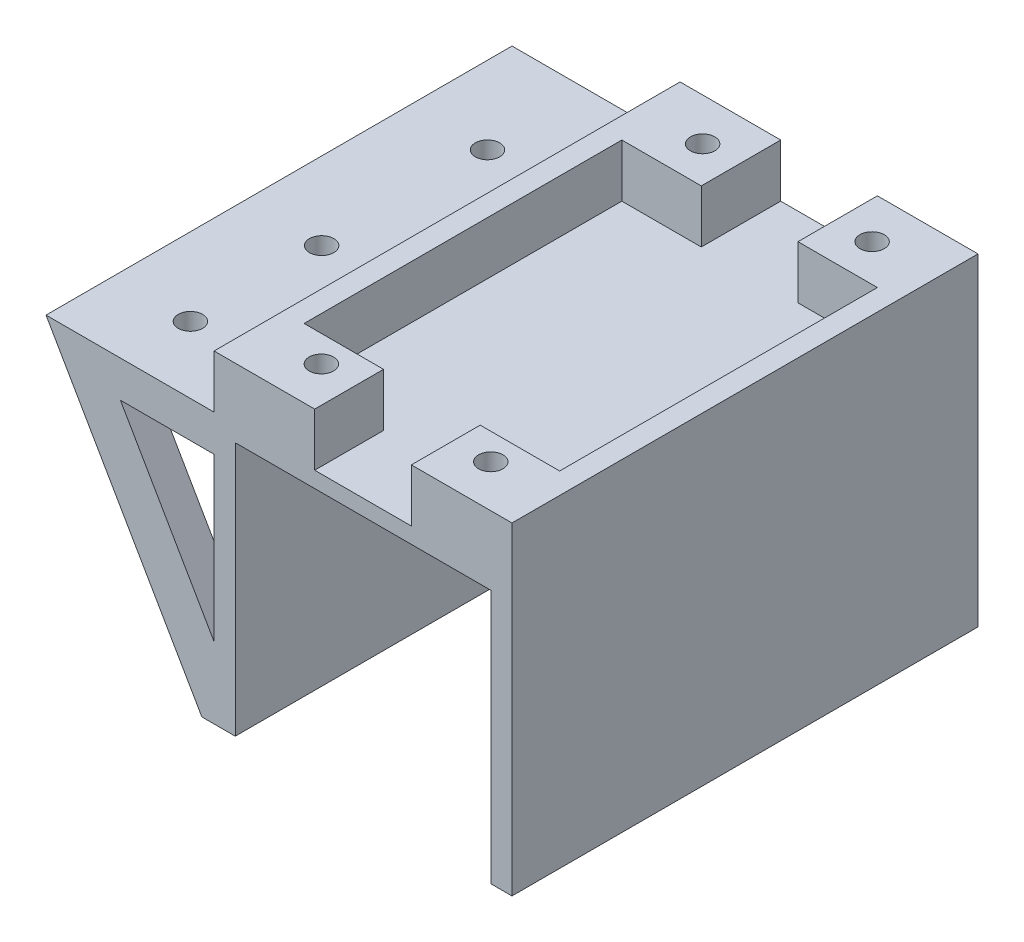
from build123d import *

# Parameters (mm, degrees)
SKETCH1_W            = 48.254
SKETCH1_H            = 10
BOSS_EXTRUDE1_DEPTH  = 70
BOSS_EXTRUDE3_DEPTH  = 8
BOSS_EXTRUDE4_DEPTH  = 8
BOSS_EXTRUDE5_DEPTH  = 8
BOSS_EXTRUDE6_DEPTH  = 70
SKETCH7_W            = 40.394634483
SKETCH7_H            = 17
CUT_EXTRUDE3_DEPTH   = 70
BOSS_EXTRUDE7_DEPTH  = 70
BOSS_EXTRUDE10_DEPTH = 8
BOSS_EXTRUDE11_DEPTH = 70
SKETCH13_W           = 83.001411072
SKETCH13_H           = 87.868559997
CUT_EXTRUDE4_DEPTH   = 4
SKETCH14_W           = 48.254
SKETCH14_H           = 10
BOSS_EXTRUDE12_DEPTH = 20
SKETCH16_W           = 56.254
SKETCH16_H           = 5
CUT_EXTRUDE5_DEPTH   = 100
SKETCH17_W           = 15
SKETCH17_H           = 15
BOSS_EXTRUDE14_DEPTH = 13
CUT_EXTRUDE8_DEPTH   = 5
SKETCH21_R           = 2.3
CUT_EXTRUDE9_DEPTH   = 15
SKETCH23_W           = 12
SKETCH23_H           = 40.530858039
CUT_EXTRUDE10_DEPTH  = 9
SKETCH25_R           = 2.3
CUT_EXTRUDE11_DEPTH  = 20
SKETCH26_R           = 2.3
CUT_EXTRUDE12_DEPTH  = 20
BOSS_EXTRUDE16_DEPTH = 20
SKETCH28_W           = 15
SKETCH28_H           = 15
BOSS_EXTRUDE17_DEPTH = 10
SKETCH29_R           = 2.3
CUT_EXTRUDE13_DEPTH  = 20
SKETCH30_W           = 10.391026801
SKETCH30_H           = 12
BOSS_EXTRUDE18_DEPTH = 5
SKETCH31_R           = 2.3
CUT_EXTRUDE14_DEPTH  = 45
SKETCH36_R           = 60.036471347
CUT_EXTRUDE15_DEPTH  = 2


with BuildPart() as part:
    # Sketch1 → Boss-Extrude1 (new body)
    with BuildSketch(Plane.XY):
        Polygon((0, 70), (0, 0), (4, 0), (4, 52), (52.254, 52), (52.254, 0), (56.254, 0), (56.254, 70), align=None)
        with Locations((28.127, 60)):
            Rectangle(SKETCH1_W, SKETCH1_H, mode=Mode.SUBTRACT)
    extrude(amount=BOSS_EXTRUDE1_DEPTH)

    # Sketch3 → Boss-Extrude3 (add)
    with BuildSketch(Plane.XY.offset(70)):
        Polygon((0, 62.5), (0, 70), (-40.394634483, 70), (0, 0.034440722), (0, 17.466679003), (-26, 62.5), align=None)
    extrude(amount=-BOSS_EXTRUDE3_DEPTH)

    # Sketch4 → Boss-Extrude4 (add)
    with BuildSketch(Plane(origin=(0, 0, 0), x_dir=(-1, 0, 0), z_dir=(0, 0, -1))):
        Polygon((0, 70), (40.394634483, 70), (0, 0), (0, 17.466679003), (26, 62.5), (0, 62.5), align=None)
    extrude(amount=-BOSS_EXTRUDE4_DEPTH)

    # Sketch5 → Boss-Extrude5 (add)
    with BuildSketch(Plane(origin=(0, 0, 39), x_dir=(-1, 0, 0), z_dir=(0, 0, -1))):
        Polygon((0, 62.5), (0, 70), (40.394634483, 70), (0, 0), (0, 17.466679003), (26, 62.5), align=None)
    extrude(amount=BOSS_EXTRUDE5_DEPTH)

    # Sketch6 → Boss-Extrude6 (add)
    with BuildSketch(Plane(origin=(0, 0, 0), x_dir=(-1, 0, 0), z_dir=(0, 0, -1))):
        Polygon((0, 62.5), (36.066637932, 62.5), (40.394634483, 70), (0, 70), align=None)
        Polygon((-4, 0), (0, 0), (7.50186069, 13), (-4, 13), align=None)
    extrude(amount=-BOSS_EXTRUDE6_DEPTH)

    # Sketch7 → Cut-Extrude3 (cut)
    with BuildSketch(Plane.XY.offset(70)):
        with Locations((-20.197317242, 61.5)):
            Rectangle(SKETCH7_W, SKETCH7_H)
    extrude(amount=-CUT_EXTRUDE3_DEPTH, mode=Mode.SUBTRACT)

    # Sketch8 → Boss-Extrude7 (add)
    with BuildSketch(Plane(origin=(0, 0, 0), x_dir=(-1, 0, 0), z_dir=(0, 0, -1))):
        Polygon((-4, 55), (-4, 52), (30.007442759, 52), (31.73864138, 55), align=None)
    extrude(amount=-BOSS_EXTRUDE7_DEPTH)

    # Sketch11 → Boss-Extrude10 (add)
    with BuildSketch(Plane.XY.offset(70)):
        Polygon((-31.73864138, 55), (0, 0), (-3.053687451, 13), (-27.288965695, 55), align=None)
    extrude(amount=-BOSS_EXTRUDE10_DEPTH)

    # Sketch12 → Boss-Extrude11 (add)
    with BuildSketch(Plane.XY.offset(70)):
        Polygon((-31.73864138, 55), (-27.75981023, 48.105069917), (0, 48.105069917), (0, 55), align=None)
    extrude(amount=-BOSS_EXTRUDE11_DEPTH)

    # Sketch13 → Cut-Extrude4 (cut)
    with BuildSketch(Plane.XZ):
        with Locations((25.938658228, 33.313825886)):
            Rectangle(SKETCH13_W, SKETCH13_H)
    extrude(amount=-CUT_EXTRUDE4_DEPTH, mode=Mode.SUBTRACT)

    # Sketch14 → Boss-Extrude12 (add)
    with BuildSketch(Plane.XY.offset(70)):
        Polygon((-2.308264828, 4), (-31.73864138, 55), (0, 55), (0, 70), (56.254, 70), (56.254, 4), (52.254, 4), (52.254, 52), (4, 52), (4, 4), align=None)
        Polygon((-17.689083241, 48.105069917), (0, 48.105069917), (0, 17.466679003), align=None, mode=Mode.SUBTRACT)
        with Locations((28.127, 60)):
            Rectangle(SKETCH14_W, SKETCH14_H, mode=Mode.SUBTRACT)
    extrude(amount=BOSS_EXTRUDE12_DEPTH)

    # Sketch16 → Cut-Extrude5 (cut)
    with BuildSketch(Plane.XY.offset(90)):
        with Locations((28.127, 67.5)):
            Rectangle(SKETCH16_W, SKETCH16_H)
    extrude(amount=-CUT_EXTRUDE5_DEPTH, mode=Mode.SUBTRACT)

    # Sketch17 → Boss-Extrude14 (add)
    with BuildSketch(Plane(origin=(0, 65, 0), x_dir=(1, 0, 0), z_dir=(0, 1, 0))):
        with Locations((44.754, -7.5)):
            Rectangle(SKETCH17_W, SKETCH17_H)
        with Locations((44.754, -82.5)):
            Rectangle(SKETCH17_W, SKETCH17_H)
    extrude(amount=-BOSS_EXTRUDE14_DEPTH)

    # Sketch22 → Cut-Extrude8 (cut)
    with BuildSketch(Plane.XZ.offset(-52)):
        Polygon((48.096455918, 6.003620146), (47.904143628, 10.329474511), (44.06168771, 12.325854365), (40.411544082, 9.996379854), (40.603856372, 5.670525489), (44.44631229, 3.674145635), align=None)
        Polygon((45.200685086, 75.774625774), (48.386623963, 78.707166221), (47.439938877, 82.932540447), (43.307314914, 84.225374226), (40.121376037, 81.292833779), (41.068061123, 77.067459553), align=None)
    extrude(amount=-CUT_EXTRUDE8_DEPTH, mode=Mode.SUBTRACT)

    # Sketch21 → Cut-Extrude9 (cut)
    with BuildSketch(Plane(origin=(0, 52, 0), x_dir=(-1, 0, 0), z_dir=(0, -1, 0))):
        with Locations((-44.254, -80)):
            Circle(SKETCH21_R)
        with Locations((-44.254, -8)):
            Circle(SKETCH21_R)
    extrude(amount=-CUT_EXTRUDE9_DEPTH, mode=Mode.SUBTRACT)

    # Sketch23 → Cut-Extrude10 (cut)
    with BuildSketch(Plane(origin=(0, 0, 0), x_dir=(0, 0, 1), z_dir=(-0.8661319205837115, -0.49981546209173167, 0))):
        with Locations((76, 35.274689955)):
            Rectangle(SKETCH23_W, SKETCH23_H)
    extrude(amount=-CUT_EXTRUDE10_DEPTH, mode=Mode.SUBTRACT)

    # Sketch25 → Cut-Extrude11 (cut)
    with BuildSketch(Plane(origin=(0, 48.105069917, 0), x_dir=(-1, 0, 0), z_dir=(0, -1, 0))):
        with Locations((17.075514089, -19.30064897)):
            Circle(SKETCH25_R)
        with Locations((17.075514089, -50.613733273)):
            Circle(SKETCH25_R)
    extrude(amount=-CUT_EXTRUDE11_DEPTH, mode=Mode.SUBTRACT)

    # Sketch26 → Cut-Extrude12 (cut)
    with BuildSketch(Plane.XZ.offset(-48.105069917)):
        with Locations((-17.075514089, 75.391336138)):
            Circle(SKETCH26_R)
    extrude(amount=-CUT_EXTRUDE12_DEPTH, mode=Mode.SUBTRACT)

    # Sketch27 → Boss-Extrude16 (add)
    with BuildSketch(Plane.XY.offset(90)):
        Polygon((-23.310381194, 48.105069917), (-27.75981023, 48.105069917), (-31.73864138, 55), (-23.310381194, 55), align=None)
    extrude(amount=-BOSS_EXTRUDE16_DEPTH)

    # Sketch28 → Boss-Extrude17 (add)
    with BuildSketch(Plane(origin=(0, 55, 0), x_dir=(1, 0, 0), z_dir=(0, 1, 0))):
        with Locations((11.5, -7.5)):
            Rectangle(SKETCH28_W, SKETCH28_H)
        with Locations((11.5, -82.5)):
            Rectangle(SKETCH28_W, SKETCH28_H)
    extrude(amount=BOSS_EXTRUDE17_DEPTH)

    # Sketch29 → Cut-Extrude13 (cut)
    with BuildSketch(Plane(origin=(0, 52, 0), x_dir=(-1, 0, 0), z_dir=(0, -1, 0))):
        with Locations((-12.254, -8)):
            Circle(SKETCH29_R)
        with Locations((-12.254, -80)):
            Circle(SKETCH29_R)
    extrude(amount=-CUT_EXTRUDE13_DEPTH, mode=Mode.SUBTRACT)

    # Sketch30 → Boss-Extrude18 (add)
    with BuildSketch(Plane.XZ.offset(-48.105069917)):
        with Locations((-22.56429683, 76)):
            Rectangle(SKETCH30_W, SKETCH30_H)
    extrude(amount=-BOSS_EXTRUDE18_DEPTH)

    # Sketch31 → Cut-Extrude14 (cut)
    with BuildSketch(Plane.XZ.offset(-48.105069917)):
        with Locations((-17.075514089, 75.391336138)):
            Circle(SKETCH31_R)
    extrude(amount=-CUT_EXTRUDE14_DEPTH, mode=Mode.SUBTRACT)

    # Sketch36 → Cut-Extrude15 (cut)
    with BuildSketch(Plane.XY.offset(90)):
        with Locations((23.036116276, 36.93280147)):
            Circle(SKETCH36_R)
    extrude(amount=-CUT_EXTRUDE15_DEPTH, mode=Mode.SUBTRACT)


solid = part.part
